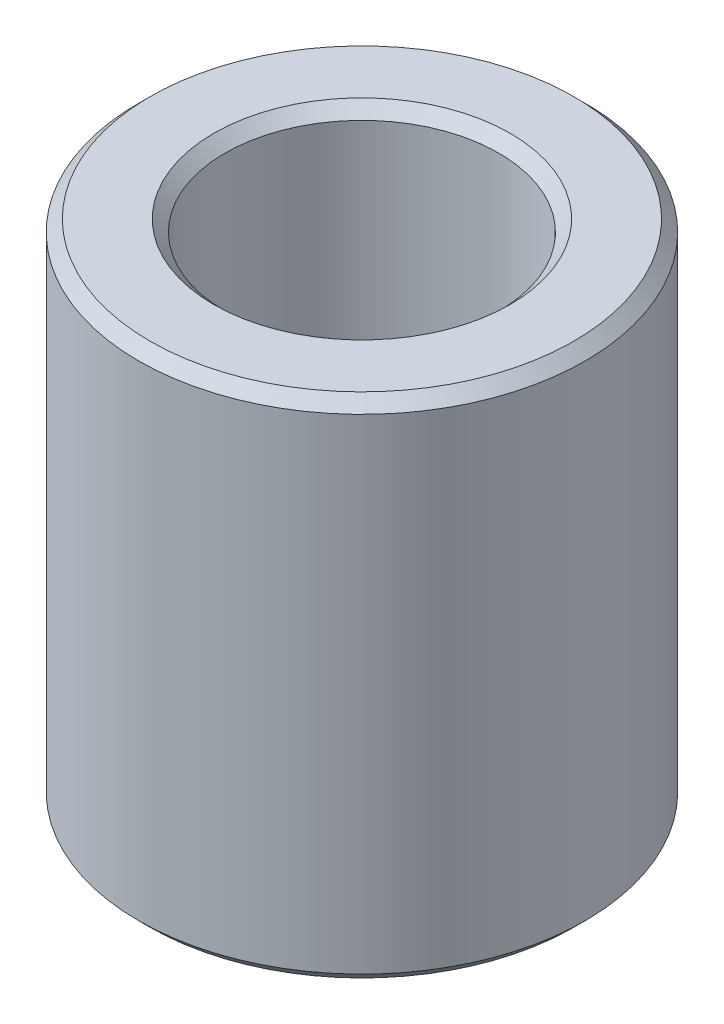
from build123d import *

# Parameters (mm, degrees)
SKETCH1_R           = 20
BOSS_EXTRUDE1_DEPTH = 45.469369064
SKETCH2_R           = 12.259883896
CUT_EXTRUDE1_DEPTH  = 54.548702347
CHAMFER1_SIZE       = 1.022409509


with BuildPart() as part:
    # Sketch1 → Boss-Extrude1 (new body)
    with BuildSketch(Plane(origin=(0, 0, 0), x_dir=(1, 0, 0), z_dir=(0, 1, 0))):
        Circle(SKETCH1_R)
    extrude(amount=BOSS_EXTRUDE1_DEPTH)

    # Sketch2 → Cut-Extrude1 (cut, through all)
    with BuildSketch(Plane(origin=(0, 0, 0), x_dir=(1, 0, 0), z_dir=(0, 1, 0))):
        Circle(SKETCH2_R)
    extrude(amount=CUT_EXTRUDE1_DEPTH, mode=Mode.SUBTRACT)

    # Chamfer1
    chamfer1_edges = [part.edges().sort_by_distance(p)[0] for p in [
        (-12.259883896, 45.469369064, 0),
        (-12.259883896, 0, 0),
        (-20, 0, 0),
        (-20, 45.469369064, 0),
    ]]
    chamfer(chamfer1_edges, length=CHAMFER1_SIZE)


solid = part.part
